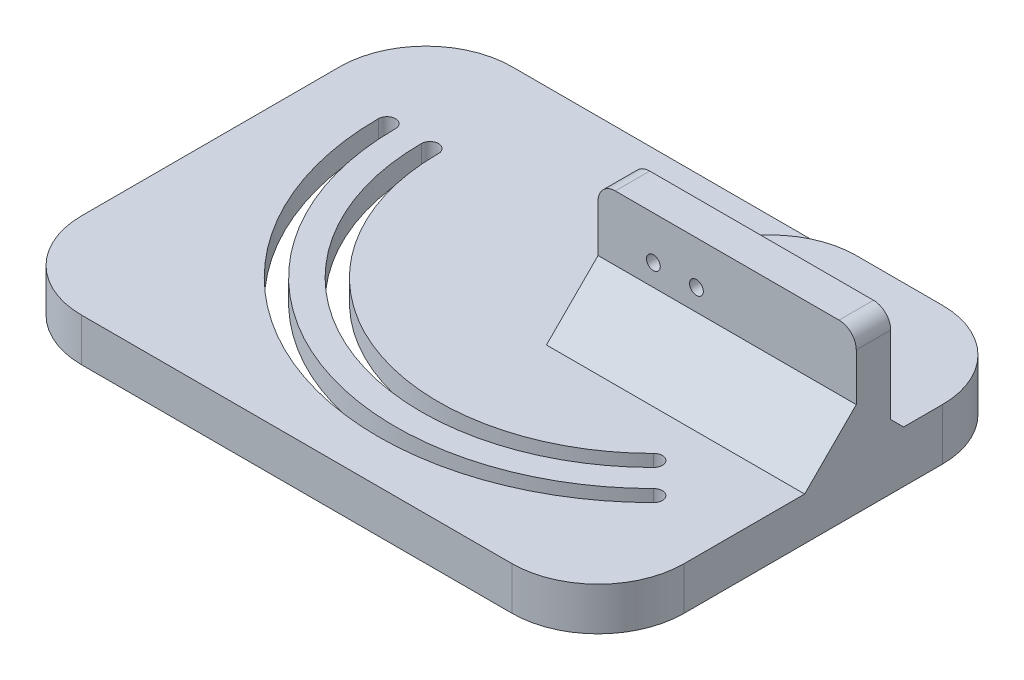
from build123d import *

# Parameters (mm, degrees)
SKETCH1_W           = 170
SKETCH1_H           = 120
BOSS_EXTRUDE1_DEPTH = 10
SKETCH2_W           = 60
SKETCH2_H           = 40
BOSS_EXTRUDE2_DEPTH = 2
SKETCH3_W           = 60
SKETCH3_H           = 8
BOSS_EXTRUDE3_DEPTH = 25
SKETCH4_R           = 1.6
CUT_EXTRUDE1_DEPTH  = 10
CUT_EXTRUDE2_DEPTH  = 36
CHAMFER1_SIZE       = 12
FILLET4_R           = 4
CHAMFER2_SIZE       = 3
CUT_EXTRUDE4_DEPTH  = 5
CUT_EXTRUDE5_DEPTH  = 19
FILLET5_R           = 20


with BuildPart() as part:
    # Sketch1 → Boss-Extrude1 (new body)
    with BuildSketch(Plane(origin=(0, 0, 0), x_dir=(1, 0, 0), z_dir=(0, 1, 0))):
        with Locations((85, 60)):
            Rectangle(SKETCH1_W, SKETCH1_H)
    extrude(amount=BOSS_EXTRUDE1_DEPTH)

    # Sketch2 → Boss-Extrude2 (add)
    with BuildSketch(Plane(origin=(0, 10, 0), x_dir=(1, 0, 0), z_dir=(0, 1, 0))):
        with Locations((140, 100)):
            Rectangle(SKETCH2_W, SKETCH2_H)
    extrude(amount=BOSS_EXTRUDE2_DEPTH)

    # Sketch3 → Boss-Extrude3 (add)
    with BuildSketch(Plane(origin=(0, 12, 0), x_dir=(1, 0, 0), z_dir=(0, 1, 0))):
        with Locations((140, 84)):
            Rectangle(SKETCH3_W, SKETCH3_H)
    extrude(amount=BOSS_EXTRUDE3_DEPTH)

    # Sketch4 → Cut-Extrude1 (cut)
    with BuildSketch(Plane(origin=(0, 0, -88), x_dir=(-1, 0, 0), z_dir=(0, 0, -1))):
        with Locations((-132.854949503, 27)):
            Circle(SKETCH4_R)
        with Locations((-122.854949503, 27)):
            Circle(SKETCH4_R)
    extrude(amount=-CUT_EXTRUDE1_DEPTH, mode=Mode.SUBTRACT)

    # Sketch5 → Cut-Extrude2 (cut)
    with BuildSketch(Plane(origin=(0, 10, 0), x_dir=(1, 0, 0), z_dir=(0, 1, 0))):
        with BuildLine():
            ThreePointArc((48.934842869, 94), (46.934842869, 96), (44.934842869, 94))
            ThreePointArc((44.934842869, 94), (84.443103198, 34.871709919), (154.189676865, 48.745166004))
            ThreePointArc((154.189676865, 48.745166004), (154.189676865, 51.573593129), (151.361249741, 51.573593129))
            ThreePointArc((151.361249741, 51.573593129), (85.973836928, 38.567228049), (48.934842869, 94))
        make_face()
        with BuildLine():
            ThreePointArc((144.290181929, 58.644660941), (89.800671251, 47.806023374), (58.934842869, 94))
            ThreePointArc((58.934842869, 94), (56.934842869, 96), (54.934842869, 94))
            ThreePointArc((54.934842869, 94), (88.269937522, 44.110505244), (147.118609054, 55.816233816))
            ThreePointArc((147.118609054, 55.816233816), (147.118609054, 58.644660941), (144.290181929, 58.644660941))
        make_face()
    extrude(amount=-CUT_EXTRUDE2_DEPTH, mode=Mode.SUBTRACT)

    # Chamfer1
    chamfer1_edges = [part.edges().sort_by_distance(p)[0] for p in [
        (140, 10, -80),
    ]]
    chamfer(chamfer1_edges, length=CHAMFER1_SIZE)

    # Fillet4
    fillet4_edges = [part.edges().sort_by_distance(p)[0] for p in [
        (170, 37, -84),
        (110, 37, -84),
    ]]
    fillet(fillet4_edges, radius=FILLET4_R)

    # Chamfer2
    chamfer2_edges = [part.edges().sort_by_distance(p)[0] for p in [
        (140, 12, -88),
    ]]
    chamfer(chamfer2_edges, length=CHAMFER2_SIZE)

    # Sketch7 → Cut-Extrude4 (cut)
    with BuildSketch(Plane.XZ):
        with BuildLine():
            ThreePointArc((140.754648023, -62.180194847), (91.714088413, -52.425421037), (63.934842869, -94))
            ThreePointArc((63.934842869, -94), (51.934842869, -106), (39.934842869, -94))
            ThreePointArc((39.934842869, -94), (82.529686036, -30.252312257), (157.725210771, -45.209632098))
            ThreePointArc((157.725210771, -45.209632098), (157.725210771, -62.180194847), (140.754648023, -62.180194847))
        make_face()
    extrude(amount=-CUT_EXTRUDE4_DEPTH, mode=Mode.SUBTRACT)

    # Sketch8 → Cut-Extrude5 (cut)
    with BuildSketch(Plane(origin=(0, 10, 0), x_dir=(1, 0, 0), z_dir=(0, 1, 0))):
        Polygon((0, 0), (30, 0), (170, 0), (170, 20), (30, 20), (30, 120), (0, 120), align=None)
    extrude(amount=-CUT_EXTRUDE5_DEPTH, mode=Mode.SUBTRACT)

    # Fillet5
    fillet5_edges = [part.edges().sort_by_distance(p)[0] for p in [
        (30, 5, -120),
        (170, 6, -120),
        (110, 11, -120),
        (30, 5, -20),
        (170, 5, -20),
    ]]
    fillet(fillet5_edges, radius=FILLET5_R)


solid = part.part
